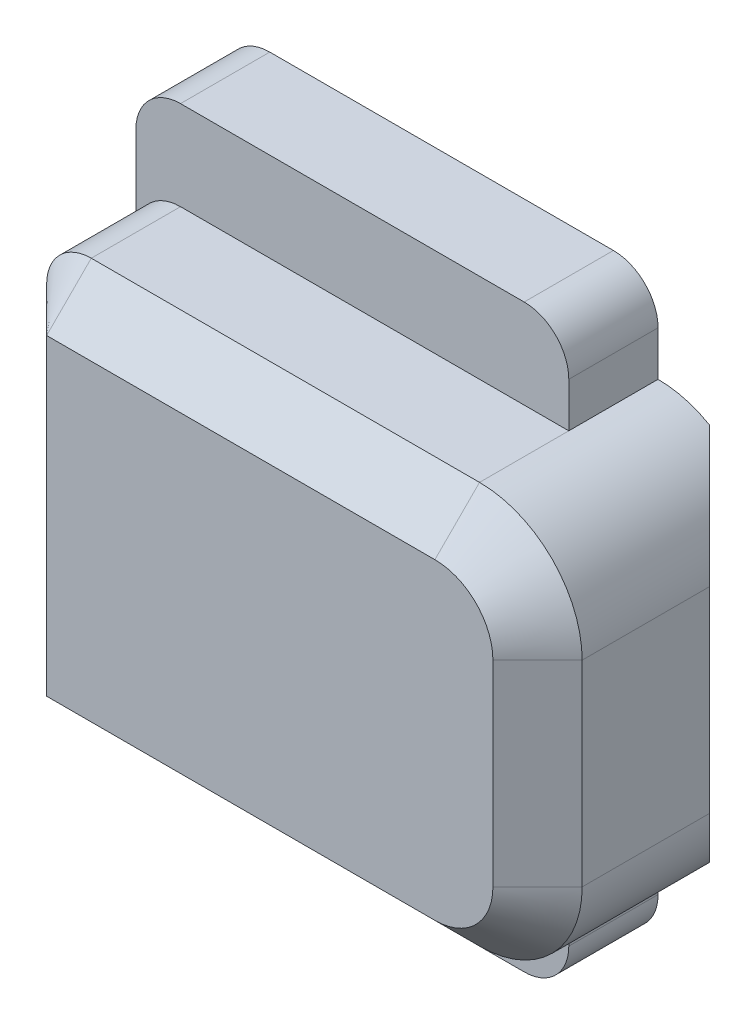
from build123d import *

# Parameters (mm, degrees)
EXTRUDE_1_DEPTH     = 2.5
SKETCH_2_W          = 15.8
SKETCH_2_H          = 6.5
EXTRUDE_2_DEPTH     = 1
FILLET_1_R          = 0.5
CUT_EXTRUDE_1_DEPTH = 12.419391402
SKETCH_4_W          = 12.1
SKETCH_4_H          = 6.5
CUT_EXTRUDE_2_DEPTH = 11.932177276
FILLET_2_R          = 0.5
CHAMFER_1_SIZE      = 0.5


with BuildPart() as part:
    # 草图1 → 凸台-拉伸1 (new body)
    with BuildSketch(Plane.XY):
        with BuildLine():
            Line((-9.05, -1.25), (-9.05, -3.45))
            ThreePointArc((-9.05, -3.45), (-8.713172798, -4.263172798), (-7.9, -4.6))
            Line((-7.9, -4.6), (7.9, -4.6))
            ThreePointArc((7.9, -4.6), (8.713172798, -4.263172798), (9.05, -3.45))
            Line((9.05, -3.45), (9.05, -1.25))
            ThreePointArc((9.05, -1.25), (8.713172798, -0.436827202), (7.9, -0.1))
            Line((7.9, -0.1), (-7.9, -0.1))
            ThreePointArc((-7.9, -0.1), (-8.713172798, -0.436827202), (-9.05, -1.25))
        make_face()
    extrude(amount=-EXTRUDE_1_DEPTH)

    # 草图2 → 凸台-拉伸2 (add)
    with BuildSketch(Plane(origin=(0, 0, -2.5), x_dir=(-1, 0, 0), z_dir=(0, 0, -1))):
        with Locations((0, -2.35)):
            Rectangle(SKETCH_2_W, SKETCH_2_H)
    extrude(amount=-EXTRUDE_2_DEPTH)

    # 圆角1
    fillet_1_edges = [part.edges().sort_by_distance(p)[0] for p in [
        (-7.9, 0.9, -2),
        (-7.9, -5.6, -2),
        (7.9, -5.6, -2),
        (7.9, 0.9, -2),
    ]]
    fillet(fillet_1_edges, radius=FILLET_1_R)

    # 草图3 → 切除-拉伸1 (cut, through all)
    with BuildSketch(Plane(origin=(0, 0.9, 0), x_dir=(1, 0, 0), z_dir=(0, 1, 0))):
        Polygon((8.475, 2.5), (9.05, 1.925), (9.05, 2.5), align=None)
        Polygon((-9.05, 1.925), (-9.05, 2.5), (-8.475, 2.5), align=None)
    extrude(amount=-CUT_EXTRUDE_1_DEPTH, mode=Mode.SUBTRACT)

    # 草图4 → 切除-拉伸2 (cut, through all)
    with BuildSketch(Plane(origin=(0, 0, -2.5), x_dir=(-1, 0, 0), z_dir=(0, 0, -1))):
        with Locations((3, -2.35)):
            Rectangle(SKETCH_4_W, SKETCH_4_H)
    extrude(amount=-CUT_EXTRUDE_2_DEPTH, mode=Mode.SUBTRACT)

    # 圆角2
    fillet_2_edges = [part.edges().sort_by_distance(p)[0] for p in [
        (3.05, -4.6, -0.75),
        (3.05, -0.1, -0.75),
        (3.05, 0.9, -2),
        (3.05, -5.6, -2),
    ]]
    fillet(fillet_2_edges, radius=FILLET_2_R)

    # 倒角1
    chamfer_1_edges = [part.edges().sort_by_distance(p)[0] for p in [
        (3.05, -2.35, 0),
        (5.725, -4.6, 0),
        (3.196446609, -0.246446609, 0),
        (3.196446609, -4.453553391, 0),
        (5.725, -0.1, 0),
        (8.713172798, -0.436827202, 0),
        (9.05, -2.35, 0),
        (8.713172798, -4.263172798, 0),
    ]]
    chamfer(chamfer_1_edges, length=CHAMFER_1_SIZE - 0.0001)  # a hair under: the kernel refuses the full size


solid = part.part
